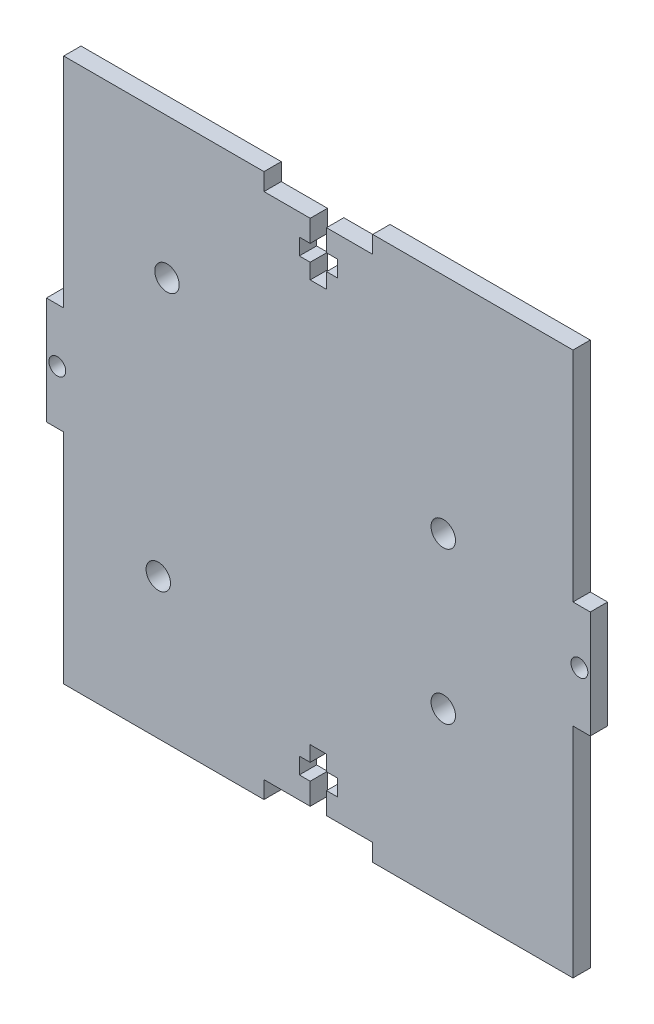
from build123d import *

# Parameters (mm, degrees)
SKETCH1_W           = 100
SKETCH1_H           = 100
BOSS_EXTRUDE2_DEPTH = 3.18
SKETCH2_R           = 1.55
SKETCH2_W           = 3.18
SKETCH2_H           = 40.125
CUT_EXTRUDE1_DEPTH  = 71.782147467
SKETCH3_R           = 2.25
CUT_EXTRUDE2_DEPTH  = 71.782147467


with BuildPart() as part:
    # Sketch1 → Boss-Extrude2 (new body)
    with BuildSketch(Plane.XY):
        Rectangle(SKETCH1_W, SKETCH1_H)
    extrude(amount=BOSS_EXTRUDE2_DEPTH)

    # Sketch2 → Cut-Extrude1 (cut, through all)
    with BuildSketch(Plane.XY.offset(3.18)):
        with Locations((-48, 0)):
            Circle(SKETCH2_R)
        Polygon((-10, 50), (-10, 46.82), (-1.5, 46.82), (-1.5, 42.82), (-3.5, 42.82), (-3.5, 39.82), (-1.5, 39.82), (-1.5, 37), (1.5, 37), (1.5, 39.82), (3.5, 39.82), (3.5, 42.82), (1.5, 42.82), (1.5, 46.82), (10, 46.82), (10, 50), align=None)
        with Locations((-48.41, 29.9375)):
            Rectangle(SKETCH2_W, SKETCH2_H)
        with Locations((-48.41, -29.9375)):
            Rectangle(SKETCH2_W, SKETCH2_H)
    cut_extrude1 = extrude(amount=-CUT_EXTRUDE1_DEPTH, mode=Mode.SUBTRACT)

    # Mirror1: Cut-Extrude1 across plane
    add(cut_extrude1.mirror(Plane.ZX), mode=Mode.SUBTRACT)

    # Mirror3: Cut-Extrude1 across plane
    add(cut_extrude1.mirror(Plane(origin=(0, 0, 0), x_dir=(0, 0, 1), z_dir=(1, 0, 0))), mode=Mode.SUBTRACT)

    # Sketch3 → Cut-Extrude2 (cut, through all)
    with BuildSketch(Plane(origin=(0, 0, 0), x_dir=(-1, 0, 0), z_dir=(0, 0, -1))):
        with Locations((27.832447704, 24.15)):
            Circle(SKETCH3_R)
        with Locations((29.432447704, -24.15)):
            Circle(SKETCH3_R)
        with Locations((-22.967552296, -19.05)):
            Circle(SKETCH3_R)
        with Locations((-22.967552296, 8.85)):
            Circle(SKETCH3_R)
    extrude(amount=-CUT_EXTRUDE2_DEPTH, mode=Mode.SUBTRACT)


solid = part.part
